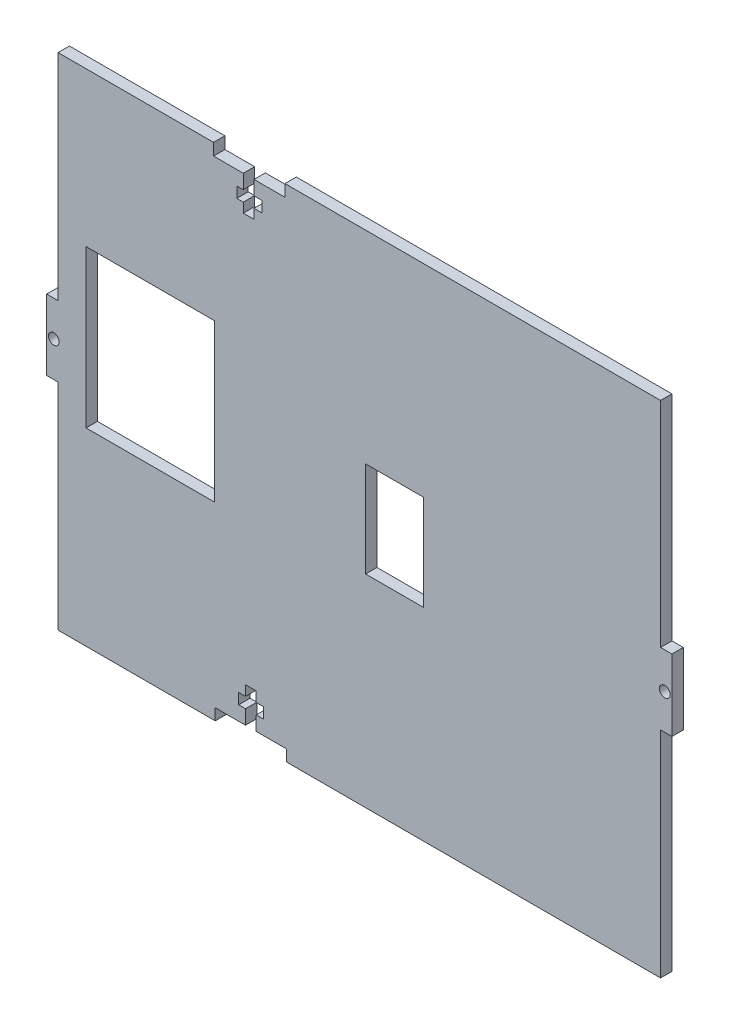
from build123d import *

# Parameters (mm, degrees)
SKETCH1_W           = 175
SKETCH1_H           = 140
BOSS_EXTRUDE1_DEPTH = 3.18
SKETCH2_R           = 1.5
SKETCH2_W           = 3.18
SKETCH2_H           = 60.125
SKETCH2_H_2         = 64.054089404
SKETCH2_H_3         = 65
CUT_EXTRUDE1_DEPTH  = 113.099787689
SKETCH12_W          = 36.012104279
SKETCH12_H          = 43.960205632
CUT_EXTRUDE6_DEPTH  = 113.099787689
SKETCH13_W          = 16.174082381
SKETCH13_H          = 26.705141904
CUT_EXTRUDE7_DEPTH  = 113.099787689
CUT_EXTRUDE11_DEPTH = 10


with BuildPart() as part:
    # Sketch1 → Boss-Extrude1 (new body)
    with BuildSketch(Plane.XY):
        Rectangle(SKETCH1_W, SKETCH1_H)
    extrude(amount=BOSS_EXTRUDE1_DEPTH)

    # Sketch2 → Cut-Extrude1 (cut, through all)
    with BuildSketch(Plane.XY.offset(3.18)):
        with Locations((-85.5, 0)):
            Circle(SKETCH2_R)
        with Locations((85.5, 0)):
            Circle(SKETCH2_R)
        with Locations((-85.91, 39.9375)):
            Rectangle(SKETCH2_W, SKETCH2_H)
        with Locations((-85.91, -39.9375)):
            Rectangle(SKETCH2_W, SKETCH2_H)
        with Locations((85.91, -41.902044702)):
            Rectangle(SKETCH2_W, SKETCH2_H_2)
        with Locations((85.91, 42.625)):
            Rectangle(SKETCH2_W, SKETCH2_H_3)
        Polygon((-28.854904074, -66.82), (-20.334061159, -66.82), (-20.334061159, -70), (-40.334061159, -70), (-40.334061159, -66.82), (-31.854904074, -66.82), (-31.854904074, -62.82), (-33.77295002, -62.82), (-33.77295002, -59.82), (-31.854904074, -59.82), (-31.854904074, -57), (-28.854904074, -57), (-28.854904074, -59.82), (-26.77295002, -59.82), (-26.77295002, -62.82), (-28.854904074, -62.82), align=None)
    extrude(amount=-CUT_EXTRUDE1_DEPTH, mode=Mode.SUBTRACT)

    # Sketch12 → Cut-Extrude6 (cut, through all)
    with BuildSketch(Plane(origin=(0, 0, 0), x_dir=(-1, 0, 0), z_dir=(0, 0, -1))):
        with Locations((58.477018613, 4.914539536)):
            Rectangle(SKETCH12_W, SKETCH12_H)
    extrude(amount=-CUT_EXTRUDE6_DEPTH, mode=Mode.SUBTRACT)

    # Sketch13 → Cut-Extrude7 (cut, through all)
    with BuildSketch(Plane(origin=(0, 0, 0), x_dir=(-1, 0, 0), z_dir=(0, 0, -1))):
        with Locations((-9.848843291, 0)):
            Rectangle(SKETCH13_W, SKETCH13_H)
    extrude(amount=-CUT_EXTRUDE7_DEPTH, mode=Mode.SUBTRACT)

    # Sketch11 → Cut-Extrude11 (cut)
    with BuildSketch(Plane(origin=(0, 0, 0), x_dir=(-1, 0, 0), z_dir=(0, 0, -1))):
        Polygon((20.793148035, 66.67), (29.479057969, 66.67), (29.479057969, 62.67), (27.293148035, 62.67), (27.293148035, 59.67), (29.479057969, 59.67), (29.479057969, 57), (32.479057969, 57), (32.479057969, 59.67), (34.293148035, 59.67), (34.293148035, 62.67), (32.479057969, 62.67), (32.479057969, 66.67), (40.793148035, 66.67), (40.793148035, 70), (20.793148035, 70), align=None)
    extrude(amount=-CUT_EXTRUDE11_DEPTH, mode=Mode.SUBTRACT)


solid = part.part
